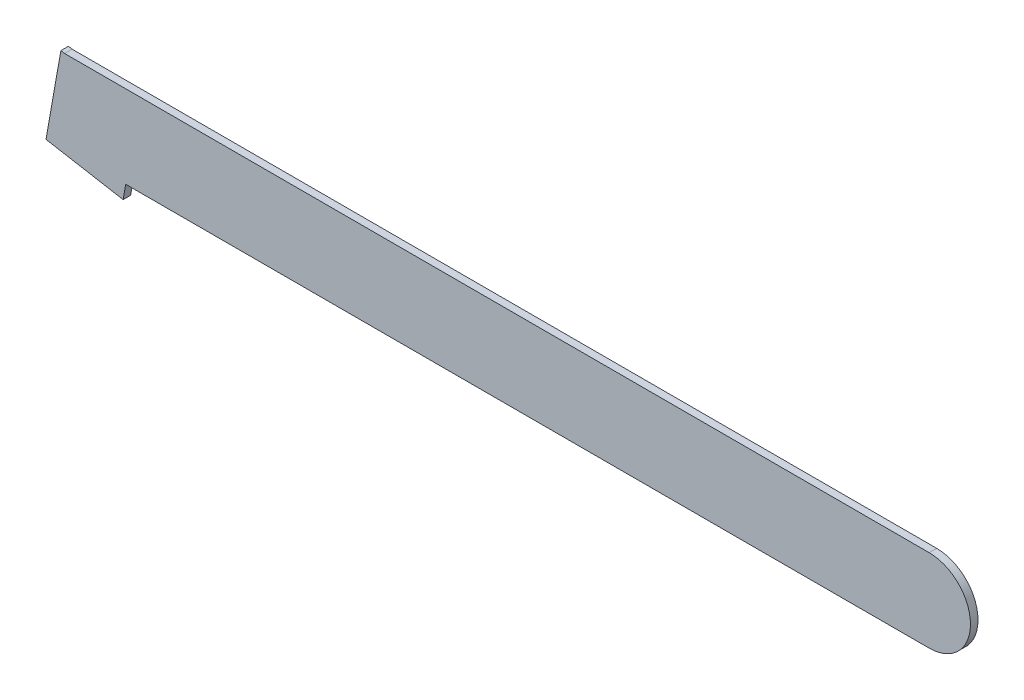
from build123d import *

# Parameters (mm, degrees)
BOSS_EXTRUDE1_DEPTH = 10


with BuildPart() as part:
    # Sketch1 → Boss-Extrude1 (new, symmetric)
    with BuildSketch(Plane.XY):
        with BuildLine():
            Line((-2300, 110.00001646), (-2309.84807753, 111.736498237))
            Line((-2309.84807753, 111.736498237), (-2344.209578927, -83.137259929))
            Line((-2344.209578927, -83.137259929), (-2349.419024257, -112.681492519))
            Line((-2349.419024257, -112.681492519), (-2144.255152103, -148.857418644))
            Line((-2144.255152103, -148.857418644), (-2137.403540795, -110))
            Line((-2137.403540795, -110), (0, -110))
            ThreePointArc((0, -110), (110.00000823, 8.23e-06), (0, 110.00001646))
            Line((0, 110.00001646), (-2300, 110.00001646))
        make_face()
    extrude(amount=BOSS_EXTRUDE1_DEPTH, both=True)


solid = part.part
